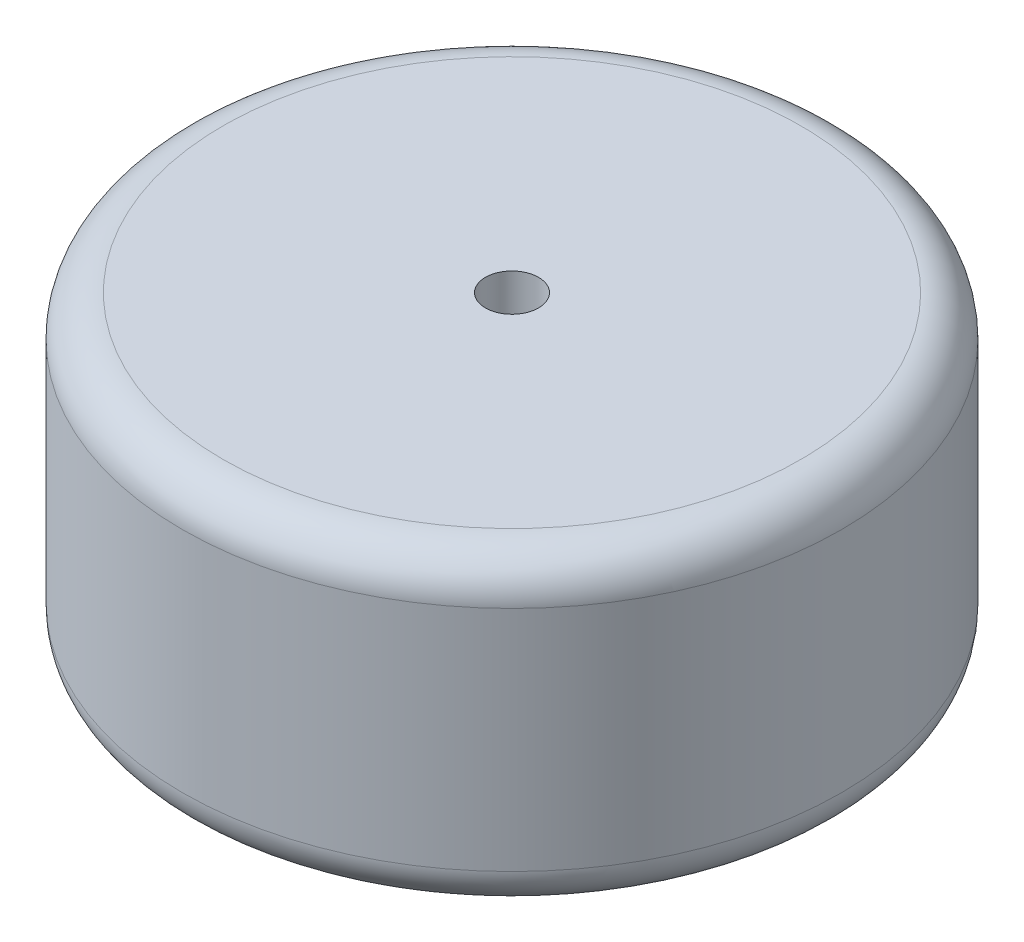
from build123d import *

# Parameters (mm, degrees)
SKETCH1_R           = 40.64
BOSS_EXTRUDE1_DEPTH = 38.100000066
FILLET1_R           = 5
SKETCH2_R           = 3.275
CUT_EXTRUDE1_DEPTH  = 69.955269655


with BuildPart() as part:
    # Sketch1 → Boss-Extrude1 (new body)
    with BuildSketch(Plane(origin=(0, 0, 0), x_dir=(1, 0, 0), z_dir=(0, 1, 0))):
        Circle(SKETCH1_R)
    extrude(amount=BOSS_EXTRUDE1_DEPTH)

    # Fillet1
    fillet1_edges = [part.edges().sort_by_distance(p)[0] for p in [
        (-40.64, 0, 0),
        (-40.64, 38.100000066, 0),
    ]]
    fillet(fillet1_edges, radius=FILLET1_R)

    # Sketch2 → Cut-Extrude1 (cut, through all)
    with BuildSketch(Plane.XZ):
        Circle(SKETCH2_R)
    extrude(amount=-CUT_EXTRUDE1_DEPTH, mode=Mode.SUBTRACT)


solid = part.part
